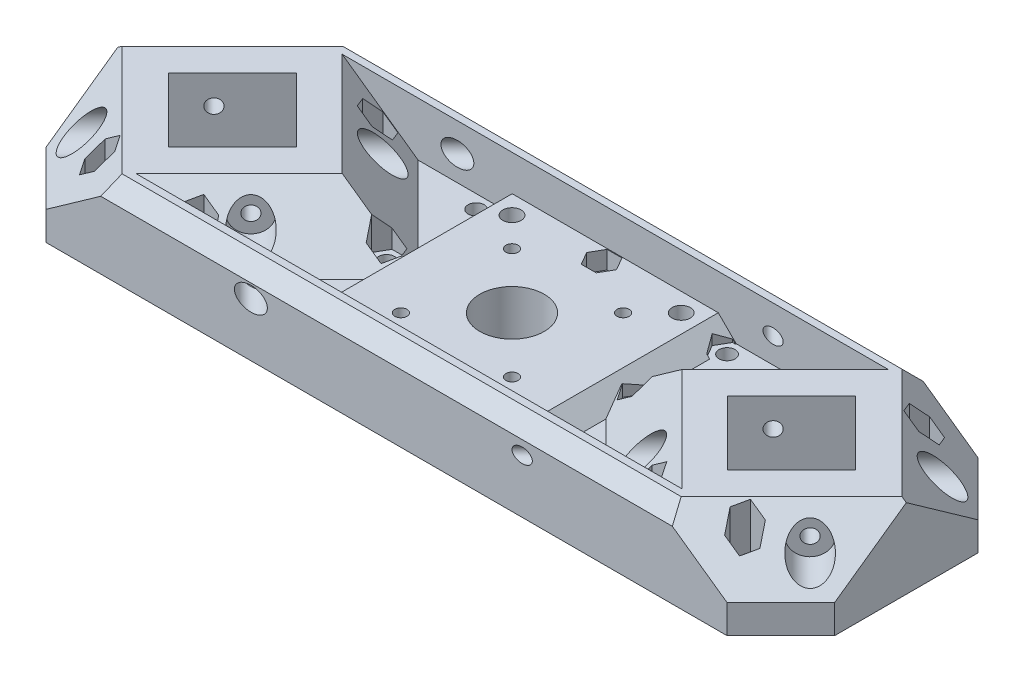
from build123d import *

# Parameters (mm, degrees)
BOSS_EXTRUDE1_DEPTH        = 23
CHAMFER1_SIZE              = 15
CHAMFER2_SIZE              = 4.2
CUT_EXTRUDE1_DEPTH         = 10
F_5_1_5_1_DIAMETER_HOLE1_D = 5.1
F_3_4_3_4_DIAMETER_HOLE1_D = 3.4
SKETCH9_R                  = 9
CUT_EXTRUDE2_DEPTH         = 117.163677628
CUT_EXTRUDE3_DEPTH         = 5
CHAMFER3_SIZE              = 15
CHAMFER4_SIZE              = 5
CUT_EXTRUDE4_DEPTH         = 117.404467268
F_4_5_4_5_DIAMETER_HOLE1_D = 4.5
SKETCH17_R                 = 2
CUT_EXTRUDE5_DEPTH         = 157.130063573
SKETCH18_R                 = 5
CUT_EXTRUDE6_DEPTH         = 13
SKETCH19_R                 = 3.25
CUT_EXTRUDE7_DEPTH         = 146.693170723
MIRROR5_COPY_1_SKETCH_R    = 2
MIRROR5_COPY_1_DEPTH       = 157.130063573
MIRROR5_COPY_2_SKETCH_R    = 5
MIRROR5_COPY_2_DEPTH       = 13
MIRROR5_COPY_3_SKETCH_R    = 2
MIRROR5_COPY_3_DEPTH       = 157.130063573
MIRROR5_COPY_4_SKETCH_R    = 5
MIRROR5_COPY_4_DEPTH       = 13
MIRROR6_COPY_1_SKETCH_R    = 2
MIRROR6_COPY_1_DEPTH       = 157.130063573
MIRROR6_COPY_2_SKETCH_R    = 5
MIRROR6_COPY_2_DEPTH       = 13
MIRROR6_COPY_3_SKETCH_R    = 2
MIRROR6_COPY_3_DEPTH       = 157.130063573
MIRROR6_COPY_4_SKETCH_R    = 5
MIRROR6_COPY_4_DEPTH       = 13
MIRROR6_COPY_5_SKETCH_R    = 2
MIRROR6_COPY_5_DEPTH       = 157.130063573
MIRROR6_COPY_6_SKETCH_R    = 5
MIRROR6_COPY_6_DEPTH       = 13


with BuildPart() as part:
    # Sketch1 → Boss-Extrude1 (new body)
    with BuildSketch(Plane(origin=(0, 0, 0), x_dir=(1, 0, 0), z_dir=(0, 1, 0))):
        Polygon((95, 35), (-95, 35), (-110, 20), (-110, -20), (-95, -35), (95, -35), (110, -20), (110, 20), align=None)
        Polygon((-95.889801564, 0), (-78, 17.889801564), (-60.110198436, 0), (-78, -17.889801564), align=None, mode=Mode.SUBTRACT)
        Polygon((60.110198436, 0), (78, -17.889801564), (95.889801564, 0), (78, 17.889801564), align=None, mode=Mode.SUBTRACT)
    extrude(amount=BOSS_EXTRUDE1_DEPTH)

    # Chamfer1
    # the kernel refuses this chamfer: 15 mm, written as the material it takes off along each edge
    with BuildSketch(Plane(origin=(67.723182802, 23, 62.276817198), x_dir=(0.019442520806013795, -0.9996219169112968, 0.019442520806013795), z_dir=(0.7071067811865476, 0, -0.7071067811865475)), Plane(origin=(137.276817198, 23, 7.276817198), x_dir=(0.019442520806014458, -0.9996219169112968, -0.019442520806014458), z_dir=(-0.7071067811865476, 0, -0.7071067811865475)), Plane(origin=(-67.723182802, 23, -62.276817198), x_dir=(-0.019442520806014028, -0.9996219169112968, -0.01944252080601402), z_dir=(-0.7071067811865475, 0, 0.7071067811865477)), Plane(origin=(-137.276817198, 23, -7.276817198), x_dir=(-0.019442520806014572, -0.9996219169112968, 0.019442520806014572), z_dir=(0.7071067811865476, 0, 0.7071067811865475))) as chamfer1_piece_1:
        Polygon((CHAMFER1_SIZE * 0.999621916911, CHAMFER1_SIZE * 0.0274958766106), (-CHAMFER1_SIZE * 0.0274958766106, CHAMFER1_SIZE * 0.999621916911), (0, 0), align=None)
    extrude(amount=98.363693075, mode=Mode.SUBTRACT)

    # Chamfer2
    chamfer2_edges = [part.edges().sort_by_distance(p)[0] for p in [
        (0, 23, 35),
        (0, 23, -35),
    ]]
    chamfer(chamfer2_edges, length=CHAMFER2_SIZE)

    # Sketch3 → Cut-Extrude1 (cut)
    with BuildSketch(Plane(origin=(0, 23, 0), x_dir=(1, 0, 0), z_dir=(0, 1, 0))):
        Polygon((-47.382276375, 0), (-76.182276375, 28.8), (76.182276375, 28.8), (47.382276375, 0), (76.182276375, -28.8), (-76.182276375, -28.8), align=None)
    extrude(amount=-CUT_EXTRUDE1_DEPTH, mode=Mode.SUBTRACT)

    # Ø5.1 (5.1) Diameter Hole1 (through all)
    with Locations(Plane(origin=(0, 13, 0), x_dir=(1, 0, 0), z_dir=(0, 1, 0))):
        with Locations((-23.6, 23.6), (-23.6, -23.6), (23.6, -23.6), (23.6, 23.6)):
            Hole(F_5_1_5_1_DIAMETER_HOLE1_D / 2)

    # Ø3.4 (3.4) Diameter Hole1 (through all)
    with Locations(Plane(origin=(0, 13, 0), x_dir=(1, 0, 0), z_dir=(0, 1, 0))):
        with Locations((-15.5, 15.5), (-15.5, -15.5), (15.5, -15.5), (15.5, 15.5)):
            Hole(F_3_4_3_4_DIAMETER_HOLE1_D / 2)

    # Sketch9 → Cut-Extrude2 (cut, through all)
    with BuildSketch(Plane(origin=(0, 13, 0), x_dir=(1, 0, 0), z_dir=(0, 1, 0))):
        with Locations(Location((0, 0, 0), (0, 0, 270))):
            Circle(SKETCH9_R)
    extrude(amount=-CUT_EXTRUDE2_DEPTH, mode=Mode.SUBTRACT)

    # Sketch10 → Cut-Extrude3 (cut)
    with BuildSketch(Plane(origin=(0, 13, 0), x_dir=(1, 0, 0), z_dir=(0, 1, 0))):
        Polygon((-28.75, 28.8), (-28.75, -28.8), (-76.182276375, -28.8), (-47.382276375, 0), (-76.182276375, 28.8), align=None)
        Polygon((28.75, 28.8), (28.75, -28.8), (76.182276375, -28.8), (47.382276375, 0), (76.182276375, 28.8), align=None)
    extrude(amount=-CUT_EXTRUDE3_DEPTH, mode=Mode.SUBTRACT)

    # Chamfer3
    # the kernel refuses this chamfer: 15 mm, written as the material it adds along each edge
    with BuildSketch(Plane(origin=(47.382276375, 8, 0), x_dir=(-0.7068394360706736, -0.02749587661058638, -0.7068394360706735), z_dir=(0.7071067811865475, 0, -0.7071067811865476))) as chamfer3_piece_1_section:
        Polygon((CHAMFER3_SIZE * 0.999621916911, CHAMFER3_SIZE * 0.0274958766106), (-CHAMFER3_SIZE * 0.0274958766106, CHAMFER3_SIZE * 0.999621916911), (0, 0), align=None)
    chamfer3_piece_1 = extrude(amount=79.304595416, mode=Mode.PRIVATE)
    chamfer3_piece_1 = split(chamfer3_piece_1, bisect_by=Plane(origin=(56.94846449, 23, -16.011270628), z_dir=(0, -1, 0)), keep=Keep.TOP, mode=Mode.PRIVATE)
    chamfer3_piece_1 = split(chamfer3_piece_1, bisect_by=Plane(origin=(56.94846449, 13.140776391, -28.8), z_dir=(0, 0, 1)), keep=Keep.TOP, mode=Mode.PRIVATE)
    add(chamfer3_piece_1)
    with BuildSketch(Plane(origin=(103.459093572, 8, 56.076817198), x_dir=(-0.7068394360706733, -0.027495876610586372, 0.7068394360706736), z_dir=(-0.7071067811865477, 0, -0.7071067811865475))) as chamfer3_piece_2_section:
        Polygon((CHAMFER3_SIZE * 0.999621916911, CHAMFER3_SIZE * 0.0274958766106), (-CHAMFER3_SIZE * 0.0274958766106, CHAMFER3_SIZE * 0.999621916911), (0, 0), align=None)
    chamfer3_piece_2 = extrude(amount=79.304595416, mode=Mode.PRIVATE)
    chamfer3_piece_2 = split(chamfer3_piece_2, bisect_by=Plane(origin=(56.94846449, 23, 16.011270628), z_dir=(0, -1, 0)), keep=Keep.TOP, mode=Mode.PRIVATE)
    chamfer3_piece_2 = split(chamfer3_piece_2, bisect_by=Plane(origin=(56.94846449, 13.140776391, 28.8), z_dir=(0, 0, -1)), keep=Keep.TOP, mode=Mode.PRIVATE)
    add(chamfer3_piece_2)
    with BuildSketch(Plane(origin=(-47.382276375, 8, 0), x_dir=(-0.019442520806014114, 0.9996219169112968, 0.019442520806014114), z_dir=(-0.7071067811865475, 0, -0.7071067811865476))) as chamfer3_piece_3_section:
        Polygon((CHAMFER3_SIZE * 0.999621916911, CHAMFER3_SIZE * 0.0274958766106), (-CHAMFER3_SIZE * 0.0274958766106, CHAMFER3_SIZE * 0.999621916911), (0, 0), align=None)
    chamfer3_piece_3 = extrude(amount=79.304595416, mode=Mode.PRIVATE)
    chamfer3_piece_3 = split(chamfer3_piece_3, bisect_by=Plane(origin=(-56.94846449, 23, -16.011270628), z_dir=(0, -1, 0)), keep=Keep.TOP, mode=Mode.PRIVATE)
    chamfer3_piece_3 = split(chamfer3_piece_3, bisect_by=Plane(origin=(-56.94846449, 13.140776391, -28.8), z_dir=(0, 0, 1)), keep=Keep.TOP, mode=Mode.PRIVATE)
    add(chamfer3_piece_3)
    with BuildSketch(Plane(origin=(-103.459093572, 8, 56.076817198), x_dir=(0.7068394360706733, -0.02749587661058638, 0.7068394360706736), z_dir=(0.7071067811865477, 0, -0.7071067811865475))) as chamfer3_piece_4_section:
        Polygon((CHAMFER3_SIZE * 0.999621916911, -CHAMFER3_SIZE * 0.0274958766106), (-CHAMFER3_SIZE * 0.0274958766106, -CHAMFER3_SIZE * 0.999621916911), (0, 0), align=None)
    chamfer3_piece_4 = extrude(amount=79.304595416, mode=Mode.PRIVATE)
    chamfer3_piece_4 = split(chamfer3_piece_4, bisect_by=Plane(origin=(-56.94846449, 23, 16.011270628), z_dir=(0, -1, 0)), keep=Keep.TOP, mode=Mode.PRIVATE)
    chamfer3_piece_4 = split(chamfer3_piece_4, bisect_by=Plane(origin=(-56.94846449, 13.140776391, 28.8), z_dir=(0, 0, -1)), keep=Keep.TOP, mode=Mode.PRIVATE)
    add(chamfer3_piece_4)
    with BuildSketch(Plane(origin=(103.459093572, 8, 56.076817198), x_dir=(-0.7068394360706733, -0.027495876610586372, 0.7068394360706736), z_dir=(-0.7071067811865477, 0, -0.7071067811865475))) as chamfer3_piece_5a_section:
        Polygon((CHAMFER3_SIZE * 0.999621916911, CHAMFER3_SIZE * 0.0274958766106), (-CHAMFER3_SIZE * 0.0274958766106, CHAMFER3_SIZE * 0.999621916911), (0, 0), align=None)
    chamfer3_piece_5a = extrude(amount=117.879840235, mode=Mode.PRIVATE)
    chamfer3_piece_5a = split(chamfer3_piece_5a, bisect_by=Plane(origin=(30.239402505, 23, -10.133943328), z_dir=(0, -1, 0)), keep=Keep.TOP, mode=Mode.PRIVATE)
    chamfer3_piece_5a = split(chamfer3_piece_5a, bisect_by=Plane(origin=(43.877811104, 12.929515007, 3.504465271), z_dir=(-0.7071067811865476, 0, -0.7071067811865475)), keep=Keep.TOP, mode=Mode.PRIVATE)
    with BuildSketch(Plane(origin=(20.105459177, 8, 27.276817198), x_dir=(-0.7068394360706736, -0.02749587661058638, -0.7068394360706735), z_dir=(0.7071067811865475, 0, -0.7071067811865476))) as chamfer3_piece_5b_section:
        Polygon((CHAMFER3_SIZE * 0.999621916911, CHAMFER3_SIZE * 0.0274958766106), (-CHAMFER3_SIZE * 0.0274958766106, CHAMFER3_SIZE * 0.999621916911), (0, 0), align=None)
    chamfer3_piece_5b = extrude(amount=117.879840235, mode=Mode.PRIVATE)
    chamfer3_piece_5b = split(chamfer3_piece_5b, bisect_by=Plane(origin=(30.239402505, 23, 10.133943328), z_dir=(0, -1, 0)), keep=Keep.TOP, mode=Mode.PRIVATE)
    chamfer3_piece_5b = split(chamfer3_piece_5b, bisect_by=Plane(origin=(43.877811104, 12.929515007, -3.504465271), z_dir=(-0.7071067811865475, 0, 0.7071067811865477)), keep=Keep.TOP, mode=Mode.PRIVATE)
    chamfer3_piece_5 = chamfer3_piece_5a & chamfer3_piece_5b
    add(chamfer3_piece_5)
    with BuildSketch(Plane(origin=(-20.105459177, 8, 27.276817198), x_dir=(-0.019442520806014257, 0.9996219169112968, 0.019442520806014257), z_dir=(-0.7071067811865475, 0, -0.7071067811865476))) as chamfer3_piece_6a_section:
        Polygon((CHAMFER3_SIZE * 0.999621916911, CHAMFER3_SIZE * 0.0274958766106), (-CHAMFER3_SIZE * 0.0274958766106, CHAMFER3_SIZE * 0.999621916911), (0, 0), align=None)
    chamfer3_piece_6a = extrude(amount=117.879840235, mode=Mode.PRIVATE)
    chamfer3_piece_6a = split(chamfer3_piece_6a, bisect_by=Plane(origin=(-30.239402505, 23, 10.133943328), z_dir=(0, -1, 0)), keep=Keep.TOP, mode=Mode.PRIVATE)
    chamfer3_piece_6a = split(chamfer3_piece_6a, bisect_by=Plane(origin=(-43.877811104, 12.929515007, -3.504465271), z_dir=(0.7071067811865475, 0, 0.7071067811865477)), keep=Keep.TOP, mode=Mode.PRIVATE)
    with BuildSketch(Plane(origin=(-103.459093572, 8, 56.076817198), x_dir=(0.7068394360706733, -0.02749587661058638, 0.7068394360706736), z_dir=(0.7071067811865477, 0, -0.7071067811865475))) as chamfer3_piece_6b_section:
        Polygon((CHAMFER3_SIZE * 0.999621916911, -CHAMFER3_SIZE * 0.0274958766106), (-CHAMFER3_SIZE * 0.0274958766106, -CHAMFER3_SIZE * 0.999621916911), (0, 0), align=None)
    chamfer3_piece_6b = extrude(amount=117.879840235, mode=Mode.PRIVATE)
    chamfer3_piece_6b = split(chamfer3_piece_6b, bisect_by=Plane(origin=(-30.239402505, 23, -10.133943328), z_dir=(0, -1, 0)), keep=Keep.TOP, mode=Mode.PRIVATE)
    chamfer3_piece_6b = split(chamfer3_piece_6b, bisect_by=Plane(origin=(-43.877811104, 12.929515007, 3.504465271), z_dir=(0.7071067811865476, 0, -0.7071067811865475)), keep=Keep.TOP, mode=Mode.PRIVATE)
    chamfer3_piece_6 = chamfer3_piece_6a & chamfer3_piece_6b
    add(chamfer3_piece_6)

    # Chamfer4
    # the kernel refuses this chamfer: 5 mm, written as the material it adds along each edge
    with BuildSketch(Plane(origin=(28.75, 8, -28.8), x_dir=(-0.027495876610586317, 0.9996219169112968, 0), z_dir=(0, 0, 1))) as chamfer4_piece_1_section:
        Polygon((CHAMFER4_SIZE * 0.999621916911, -CHAMFER4_SIZE * 0.0274958766106), (-CHAMFER4_SIZE * 0.0274958766106, -CHAMFER4_SIZE * 0.999621916911), (0, 0), align=None)
    chamfer4_piece_1 = extrude(amount=39.077487879, mode=Mode.PRIVATE)
    chamfer4_piece_1 = split(chamfer4_piece_1, bisect_by=Plane(origin=(30.298925899, 13, -15.222547061), z_dir=(0, -1, 0)), keep=Keep.TOP, mode=Mode.PRIVATE)
    add(chamfer4_piece_1)
    with BuildSketch(Plane(origin=(28.75, 8, -10.277487879), x_dir=(0.9996219169112968, -0.027495876610586317, 0), z_dir=(0, 0, 1))) as chamfer4_piece_2_section:
        Polygon((CHAMFER4_SIZE * 0.999621916911, CHAMFER4_SIZE * 0.0274958766106), (-CHAMFER4_SIZE * 0.0274958766106, CHAMFER4_SIZE * 0.999621916911), (0, 0), align=None)
    chamfer4_piece_2 = extrude(amount=39.077487879, mode=Mode.PRIVATE)
    chamfer4_piece_2 = split(chamfer4_piece_2, bisect_by=Plane(origin=(30.629508292, 13, -3.892834686), z_dir=(0, -1, 0)), keep=Keep.TOP, mode=Mode.PRIVATE)
    add(chamfer4_piece_2)
    with BuildSketch(Plane(origin=(-28.75, 8, -28.8), x_dir=(-0.9996219169112968, -0.0274958766105863, 0), z_dir=(0, 0, 1))) as chamfer4_piece_3_section:
        Polygon((CHAMFER4_SIZE * 0.999621916911, -CHAMFER4_SIZE * 0.0274958766106), (-CHAMFER4_SIZE * 0.0274958766106, -CHAMFER4_SIZE * 0.999621916911), (0, 0), align=None)
    chamfer4_piece_3 = extrude(amount=39.077487879, mode=Mode.PRIVATE)
    chamfer4_piece_3 = split(chamfer4_piece_3, bisect_by=Plane(origin=(-30.298925899, 13, -15.222547061), z_dir=(0, -1, 0)), keep=Keep.TOP, mode=Mode.PRIVATE)
    add(chamfer4_piece_3)
    with BuildSketch(Plane(origin=(-28.75, 8, -10.277487879), x_dir=(-0.9996219169112968, -0.027495876610586317, 0), z_dir=(0, 0, 1))) as chamfer4_piece_4_section:
        Polygon((CHAMFER4_SIZE * 0.999621916911, -CHAMFER4_SIZE * 0.0274958766106), (-CHAMFER4_SIZE * 0.0274958766106, -CHAMFER4_SIZE * 0.999621916911), (0, 0), align=None)
    chamfer4_piece_4 = extrude(amount=39.077487879, mode=Mode.PRIVATE)
    chamfer4_piece_4 = split(chamfer4_piece_4, bisect_by=Plane(origin=(-30.629508292, 13, -3.892834686), z_dir=(0, -1, 0)), keep=Keep.TOP, mode=Mode.PRIVATE)
    add(chamfer4_piece_4)

    # Sketch11 → Cut-Extrude4 (cut, through all)
    with BuildSketch(Plane(origin=(0, 8, 0), x_dir=(-1, 0, 0), z_dir=(0, -1, 0))):
        Polygon((-94.156921938, 25), (-92.078460969, 21.4), (-87.921539031, 21.4), (-85.843078062, 25), (-87.921539031, 28.6), (-92.078460969, 28.6), align=None)
        Polygon((-58.343078062, 25), (-60.421539031, 28.6), (-64.578460969, 28.6), (-66.656921938, 25), (-64.578460969, 21.4), (-60.421539031, 21.4), align=None)
        Polygon((-85.843078062, -25), (-87.921539031, -21.4), (-92.078460969, -21.4), (-94.156921938, -25), (-92.078460969, -28.6), (-87.921539031, -28.6), align=None)
        Polygon((-58.343078062, -25), (-60.421539031, -21.4), (-64.578460969, -21.4), (-66.656921938, -25), (-64.578460969, -28.6), (-60.421539031, -28.6), align=None)
        Polygon((-30.843078062, -25), (-32.921539031, -21.4), (-37.078460969, -21.4), (-39.156921938, -25), (-37.078460969, -28.6), (-32.921539031, -28.6), align=None)
        Polygon((-30.843078062, 25), (-32.921539031, 28.6), (-37.078460969, 28.6), (-39.156921938, 25), (-37.078460969, 21.4), (-32.921539031, 21.4), align=None)
        Polygon((4.156921938, 25), (2.078460969, 28.6), (-2.078460969, 28.6), (-4.156921938, 25), (-2.078460969, 21.4), (2.078460969, 21.4), align=None)
        Polygon((4.156921938, -25), (2.078460969, -21.4), (-2.078460969, -21.4), (-4.156921938, -25), (-2.078460969, -28.6), (2.078460969, -28.6), align=None)
        Polygon((39.156921938, -25), (37.078460969, -21.4), (32.921539031, -21.4), (30.843078062, -25), (32.921539031, -28.6), (37.078460969, -28.6), align=None)
        Polygon((39.156921938, 25), (37.078460969, 28.6), (32.921539031, 28.6), (30.843078062, 25), (32.921539031, 21.4), (37.078460969, 21.4), align=None)
        Polygon((66.656921938, 25), (64.578460969, 28.6), (60.421539031, 28.6), (58.343078062, 25), (60.421539031, 21.4), (64.578460969, 21.4), align=None)
        Polygon((66.656921938, -25), (64.578460969, -21.4), (60.421539031, -21.4), (58.343078062, -25), (60.421539031, -28.6), (64.578460969, -28.6), align=None)
        Polygon((85.843078062, 25), (87.921539031, 21.4), (92.078460969, 21.4), (94.156921938, 25), (92.078460969, 28.6), (87.921539031, 28.6), align=None)
        Polygon((85.843078062, -25), (87.921539031, -28.6), (92.078460969, -28.6), (94.156921938, -25), (92.078460969, -21.4), (87.921539031, -21.4), align=None)
        Polygon((-30.843078062, 0), (-32.921539031, 3.6), (-37.078460969, 3.6), (-39.156921938, 0), (-37.078460969, -3.6), (-32.921539031, -3.6), align=None)
        Polygon((30.843078062, 0), (32.921539031, -3.6), (37.078460969, -3.6), (39.156921938, 0), (37.078460969, 3.6), (32.921539031, 3.6), align=None)
    extrude(amount=-CUT_EXTRUDE4_DEPTH, mode=Mode.SUBTRACT)

    # Ø4.5 (4.5) Diameter Hole1 (through all)
    with Locations(Plane(origin=(0, 8, 0), x_dir=(1, 0, 0), z_dir=(0, 1, 0))):
        with Locations((-90, 25), (-90, -25), (-62.5, -25), (-62.5, 25), (-35, 25), (-35, -25), (0, -25), (0, 25), (35, 25), (35, -25), (62.5, 25), (62.5, -25), (90, -25), (90, 25), (-35, 0), (35, 0)):
            Hole(F_4_5_4_5_DIAMETER_HOLE1_D / 2)

    # Sketch17 → Cut-Extrude5 (cut, through all)
    with BuildSketch(Plane(origin=(-30.055099218, 0, 30.055099218), x_dir=(0.7071067811865477, 0, 0.7071067811865475), z_dir=(-0.7071067811865475, 0, 0.7071067811865477))):
        with Locations((-51.504328933, 15)):
            Circle(SKETCH17_R)
    cut_extrude5 = extrude(amount=-CUT_EXTRUDE5_DEPTH, mode=Mode.SUBTRACT)

    # Sketch18 → Cut-Extrude6 (cut)
    with BuildSketch(Plane(origin=(-22.064792591, 0, 22.064792591), x_dir=(0.7071067811865477, 0, 0.7071067811865475), z_dir=(-0.7071067811865475, 0, 0.7071067811865477))):
        with Locations((-51.504328933, 15)):
            Circle(SKETCH18_R)
    cut_extrude6 = extrude(amount=-CUT_EXTRUDE6_DEPTH, mode=Mode.SUBTRACT)

    # Sketch19 → Cut-Extrude7 (cut, through all)
    with BuildSketch(Plane(origin=(-22.064792591, 0, 22.064792591), x_dir=(-0.7071067811865476, 0, -0.7071067811865476), z_dir=(0.7071067811865476, 0, -0.7071067811865476))):
        with Locations((51.504328933, 15)):
            Circle(SKETCH19_R)
    cut_extrude7 = extrude(amount=CUT_EXTRUDE7_DEPTH, mode=Mode.SUBTRACT)

    # Mirror1: Cut-Extrude5, Cut-Extrude6, Cut-Extrude7 across plane
    add(cut_extrude5.mirror(Plane.XY), mode=Mode.SUBTRACT)
    add(cut_extrude6.mirror(Plane.XY), mode=Mode.SUBTRACT)
    add(cut_extrude7.mirror(Plane.XY), mode=Mode.SUBTRACT)

    # Mirror4: Cut-Extrude5, Cut-Extrude6 across plane
    add(cut_extrude5.mirror(Plane.ZY.offset(78)), mode=Mode.SUBTRACT)
    add(cut_extrude6.mirror(Plane.ZY.offset(78)), mode=Mode.SUBTRACT)

    # Mirror5 copy 1 sketch → Mirror5 copy 1 (cut, through all)
    with BuildSketch(Plane(origin=(-125.944900782, 0, -30.055099218), x_dir=(-0.7071067811865471, 0, -0.707106781186548), z_dir=(0.707106781186548, 0, -0.7071067811865471))):
        with Locations((-51.504328933, 15)):
            Circle(MIRROR5_COPY_1_SKETCH_R)
    extrude(amount=-MIRROR5_COPY_1_DEPTH, mode=Mode.SUBTRACT)

    # Mirror5 copy 2 sketch → Mirror5 copy 2 (cut)
    with BuildSketch(Plane(origin=(-133.935207409, 0, -22.064792591), x_dir=(-0.7071067811865471, 0, -0.707106781186548), z_dir=(0.707106781186548, 0, -0.7071067811865471))):
        with Locations((-51.504328933, 15)):
            Circle(MIRROR5_COPY_2_SKETCH_R)
    extrude(amount=-MIRROR5_COPY_2_DEPTH, mode=Mode.SUBTRACT)

    # Mirror5 copy 3 sketch → Mirror5 copy 3 (cut, through all)
    with BuildSketch(Plane(origin=(-30.055099218, 0, -30.055099218), x_dir=(0.7071067811865477, 0, -0.7071067811865475), z_dir=(-0.7071067811865475, 0, -0.7071067811865477))):
        with Locations((-51.504328933, -15)):
            Circle(MIRROR5_COPY_3_SKETCH_R)
    extrude(amount=-MIRROR5_COPY_3_DEPTH, mode=Mode.SUBTRACT)

    # Mirror5 copy 4 sketch → Mirror5 copy 4 (cut)
    with BuildSketch(Plane(origin=(-22.064792591, 0, -22.064792591), x_dir=(0.7071067811865477, 0, -0.7071067811865475), z_dir=(-0.7071067811865475, 0, -0.7071067811865477))):
        with Locations((-51.504328933, -15)):
            Circle(MIRROR5_COPY_4_SKETCH_R)
    extrude(amount=-MIRROR5_COPY_4_DEPTH, mode=Mode.SUBTRACT)

    # Mirror6: Cut-Extrude5, Cut-Extrude6 across plane
    add(cut_extrude5.mirror(Plane(origin=(0, 0, 0), x_dir=(0, 0, 1), z_dir=(1, 0, 0))), mode=Mode.SUBTRACT)
    add(cut_extrude6.mirror(Plane(origin=(0, 0, 0), x_dir=(0, 0, 1), z_dir=(1, 0, 0))), mode=Mode.SUBTRACT)

    # Mirror6 copy 1 sketch → Mirror6 copy 1 (cut, through all)
    with BuildSketch(Plane(origin=(125.944900782, 0, 30.055099218), x_dir=(0.7071067811865471, 0, 0.707106781186548), z_dir=(-0.707106781186548, 0, 0.7071067811865471))):
        with Locations((-51.504328933, 15)):
            Circle(MIRROR6_COPY_1_SKETCH_R)
    extrude(amount=-MIRROR6_COPY_1_DEPTH, mode=Mode.SUBTRACT)

    # Mirror6 copy 2 sketch → Mirror6 copy 2 (cut)
    with BuildSketch(Plane(origin=(133.935207409, 0, 22.064792591), x_dir=(0.7071067811865471, 0, 0.707106781186548), z_dir=(-0.707106781186548, 0, 0.7071067811865471))):
        with Locations((-51.504328933, 15)):
            Circle(MIRROR6_COPY_2_SKETCH_R)
    extrude(amount=-MIRROR6_COPY_2_DEPTH, mode=Mode.SUBTRACT)

    # Mirror6 copy 3 sketch → Mirror6 copy 3 (cut, through all)
    with BuildSketch(Plane(origin=(125.944900782, 0, -30.055099218), x_dir=(0.7071067811865471, 0, -0.707106781186548), z_dir=(-0.707106781186548, 0, -0.7071067811865471))):
        with Locations((-51.504328933, -15)):
            Circle(MIRROR6_COPY_3_SKETCH_R)
    extrude(amount=-MIRROR6_COPY_3_DEPTH, mode=Mode.SUBTRACT)

    # Mirror6 copy 4 sketch → Mirror6 copy 4 (cut)
    with BuildSketch(Plane(origin=(133.935207409, 0, -22.064792591), x_dir=(0.7071067811865471, 0, -0.707106781186548), z_dir=(-0.707106781186548, 0, -0.7071067811865471))):
        with Locations((-51.504328933, -15)):
            Circle(MIRROR6_COPY_4_SKETCH_R)
    extrude(amount=-MIRROR6_COPY_4_DEPTH, mode=Mode.SUBTRACT)

    # Mirror6 copy 5 sketch → Mirror6 copy 5 (cut, through all)
    with BuildSketch(Plane(origin=(30.055099218, 0, -30.055099218), x_dir=(-0.7071067811865477, 0, -0.7071067811865475), z_dir=(0.7071067811865475, 0, -0.7071067811865477))):
        with Locations((-51.504328933, 15)):
            Circle(MIRROR6_COPY_5_SKETCH_R)
    extrude(amount=-MIRROR6_COPY_5_DEPTH, mode=Mode.SUBTRACT)

    # Mirror6 copy 6 sketch → Mirror6 copy 6 (cut)
    with BuildSketch(Plane(origin=(22.064792591, 0, -22.064792591), x_dir=(-0.7071067811865477, 0, -0.7071067811865475), z_dir=(0.7071067811865475, 0, -0.7071067811865477))):
        with Locations((-51.504328933, 15)):
            Circle(MIRROR6_COPY_6_SKETCH_R)
    extrude(amount=-MIRROR6_COPY_6_DEPTH, mode=Mode.SUBTRACT)


solid = part.part
